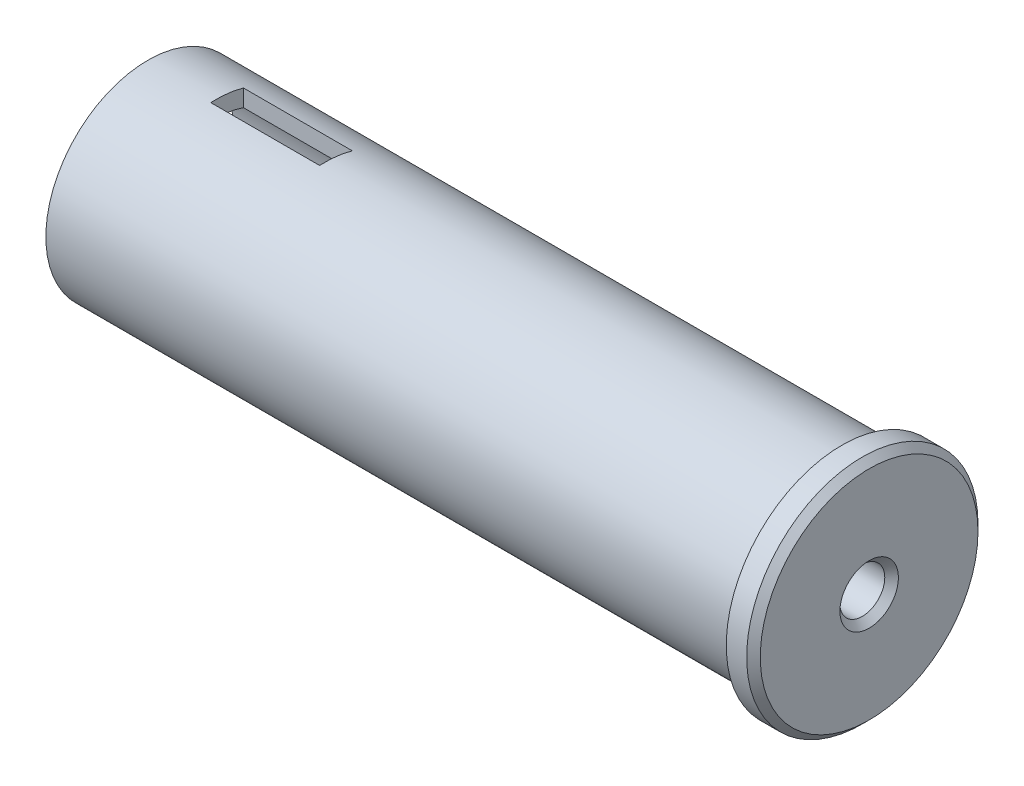
from build123d import *

# Parameters (mm, degrees)
CHAMFER2_SIZE           = 0.5
CUT_EXTRUDE1_DEPTH      = 55.346113016
CUT_EXTRUDE1_DEPTH_BACK = 55.346113016
SKETCH3_W               = 8
SKETCH3_H               = 2.4


with BuildPart() as part:
    # Sketch2 → Revolve1 (revolve)
    with BuildSketch(Plane(origin=(0, 0, 0), x_dir=(1, 0, 0), z_dir=(0, 1, 0))):
        Polygon((0, 1.65), (-11, 1.65), (-11, 6.3), (-53, 6.3), (-53, 7.5), (-2, 7.5), (-2, 8.5), (0, 8.5), align=None)
    revolve(axis=Axis((0, 0, 0), (-1, 0, 0)))

    # Chamfer2
    chamfer2_edges = [part.edges().sort_by_distance(p)[0] for p in [
        (0, 0, 1.65),
        (0, 0, 8.5),
    ]]
    chamfer(chamfer2_edges, length=CHAMFER2_SIZE)

    # Sketch3 → Cut-Extrude1 (cut, two sides: drawn at the far end of the back side and taken through both)
    with BuildSketch(Plane(origin=(0, 0, 0), x_dir=(1, 0, 0), z_dir=(0, 1, 0)).offset(-CUT_EXTRUDE1_DEPTH_BACK)):
        with Locations((-44, 0.817065344)):
            Rectangle(SKETCH3_W, SKETCH3_H)
    extrude(amount=CUT_EXTRUDE1_DEPTH + CUT_EXTRUDE1_DEPTH_BACK, mode=Mode.SUBTRACT)


solid = part.part
